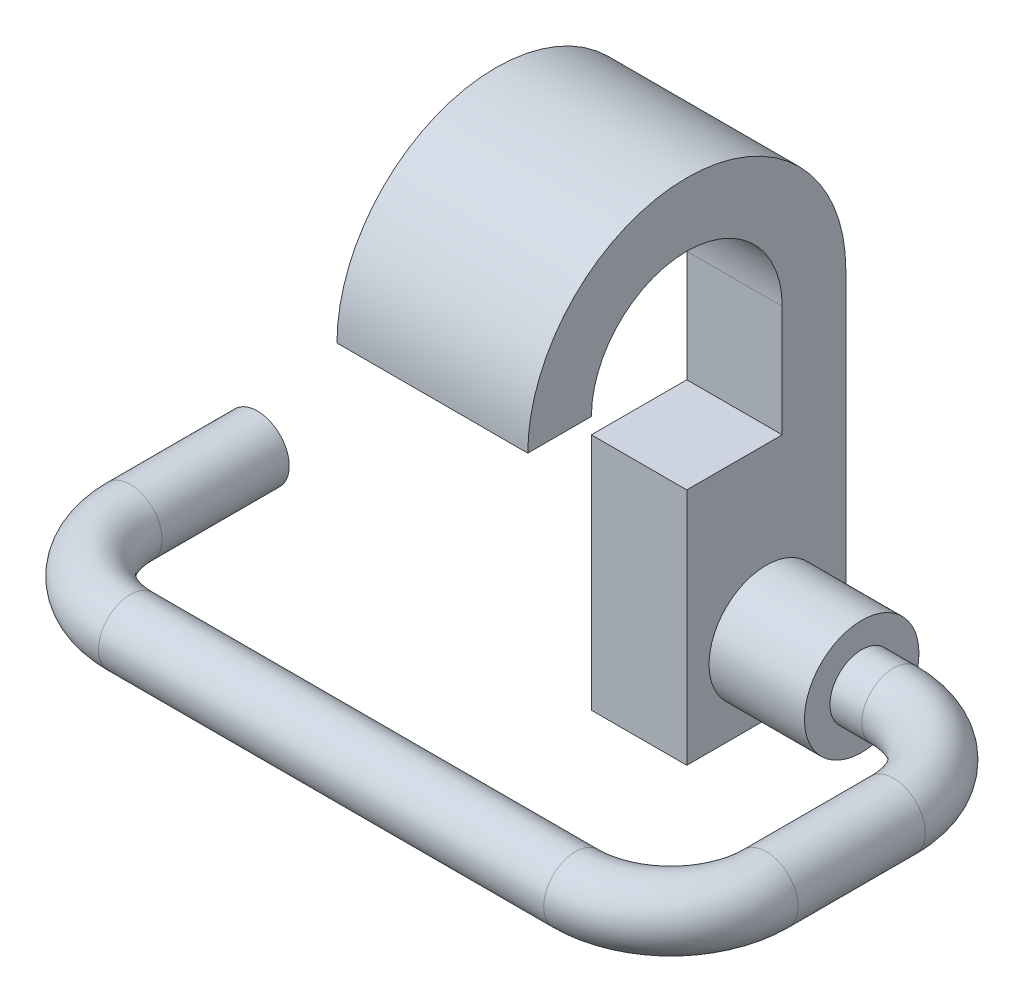
from build123d import *

# Parameters (mm, degrees)
ESBO_O1_R                 = 100
RESSALTO_EXTRUS_O2_DEPTH  = 700
ESBO_O1_9_R               = 180
ESBO_O1_9_R_2             = 100
RESSALTO_EXTRUS_O6_DEPTH  = 600
ESBO_O1_10_W              = 500
ESBO_O1_10_H              = 750
ESBO_O1_10_R              = 180
RESSALTO_EXTRUS_O7_DEPTH  = 300
ESBO_O3_W                 = 300
ESBO_O3_H                 = 200
RESSALTO_EXTRUS_O8_DEPTH  = 350
RESSALTO_EXTRUS_O9_DEPTH  = 300
VARREDURA4_OUTLINE_R      = 100
VARREDURA4_ANGLE          = 90
ESBO_O27_R                = 100
RESSALTO_EXTRUS_O16_DEPTH = 400
VARREDURA5_OUTLINE_R      = 100
VARREDURA5_ANGLE          = 90
ESBO_O33_R                = 100
RESSALTO_EXTRUS_O17_DEPTH = 700


# Read off the part's stored shape, not the designer's step: Varredura4, Varredura5
with BuildPart() as part:
    # Esboço1 → Ressalto-extrusão2 (new body)
    with BuildSketch(Plane(origin=(0, 0, 0), x_dir=(0, 0, -1), z_dir=(1, 0, 0))):
        with Locations((0, -135)):
            Circle(ESBO_O1_R)
    extrude(amount=RESSALTO_EXTRUS_O2_DEPTH)

    # Esboço1<9> → Ressalto-extrusão6 (add)
    with BuildSketch(Plane(origin=(0, 0, 0), x_dir=(0, 0, -1), z_dir=(1, 0, 0))):
        with Locations((0, -135)):
            Circle(ESBO_O1_9_R)
        with Locations((0, -135)):
            Circle(ESBO_O1_9_R_2, mode=Mode.SUBTRACT)
    extrude(amount=RESSALTO_EXTRUS_O6_DEPTH)

    # Esboço1<10> → Ressalto-extrusão7 (add)
    with BuildSketch(Plane(origin=(0, 0, 0), x_dir=(0, 0, -1), z_dir=(1, 0, 0))):
        Rectangle(ESBO_O1_10_W, ESBO_O1_10_H)
        with Locations((0, -135)):
            Circle(ESBO_O1_10_R, mode=Mode.SUBTRACT)
    extrude(amount=RESSALTO_EXTRUS_O7_DEPTH)

    # Esboço3 → Ressalto-extrusão8 (add)
    with BuildSketch(Plane(origin=(0, 375, 0), x_dir=(1, 0, 0), z_dir=(0, 1, 0))):
        with Locations((150, 150)):
            Rectangle(ESBO_O3_W, ESBO_O3_H)
    extrude(amount=RESSALTO_EXTRUS_O8_DEPTH)

    # Esboço5 → Ressalto-extrusão9 (add)
    with BuildSketch(Plane(origin=(300, 0, 0), x_dir=(0, 0, -1), z_dir=(1, 0, 0))):
        with BuildLine():
            Line((-750, 725), (-550, 725))
            ThreePointArc((-550, 725), (-250, 1025), (50, 725))
            Line((50, 725), (250, 725))
            ThreePointArc((250, 725), (-250, 1225), (-750, 725))
        make_face()
    ressalto_extrus_o9 = extrude(amount=-RESSALTO_EXTRUS_O9_DEPTH)

    # Espelhar3: Ressalto-extrusão9 across Right Plane
    add(ressalto_extrus_o9.mirror(Plane(origin=(0, 0, 0), x_dir=(0, 0, -1), z_dir=(1, 0, 0))))


with BuildPart() as body_2:
    # Varredura4 outline → Varredura4 (revolve)
    with BuildSketch(Plane(origin=(700, 0, 300), x_dir=(1, 0, 0), z_dir=(0, 0, 1))):
        with Locations((300, -135)):
            Circle(VARREDURA4_OUTLINE_R)
    revolve(axis=Axis((700, 0, 300), (0, 1, 0)), revolution_arc=VARREDURA4_ANGLE)


with BuildPart() as body_3:
    # Esboço27 → Ressalto-extrusão16 (new body)
    with BuildSketch(Plane.XY.offset(300)):
        with Locations((1000, -135)):
            Circle(ESBO_O27_R)
    ressalto_extrus_o16 = extrude(amount=RESSALTO_EXTRUS_O16_DEPTH)

    # Varredura5 outline → Varredura5 (revolve)
    with BuildSketch(Plane(origin=(700, 0, 700), x_dir=(0, 0, 1), z_dir=(-1, 0, 0))):
        with Locations((300, -135)):
            Circle(VARREDURA5_OUTLINE_R)
    varredura5 = revolve(axis=Axis((700, 0, 700), (0, 1, 0)), revolution_arc=VARREDURA5_ANGLE)

    # Esboço33 → Ressalto-extrusão17 (add)
    with BuildSketch(Plane.ZY.offset(-700)):
        with Locations((1000, -135)):
            Circle(ESBO_O33_R)
    ressalto_extrus_o17 = extrude(amount=RESSALTO_EXTRUS_O17_DEPTH)

    # Espelhar4: Ressalto-extrusão16, Varredura5, Ressalto-extrusão17 across Right Plane
    add(ressalto_extrus_o16.mirror(Plane(origin=(0, 0, 0), x_dir=(0, 0, -1), z_dir=(1, 0, 0))))
    add(varredura5.mirror(Plane(origin=(0, 0, 0), x_dir=(0, 0, -1), z_dir=(1, 0, 0))))
    add(ressalto_extrus_o17.mirror(Plane(origin=(0, 0, 0), x_dir=(0, 0, -1), z_dir=(1, 0, 0))))


solid = Compound([part.part, body_2.part, body_3.part])
